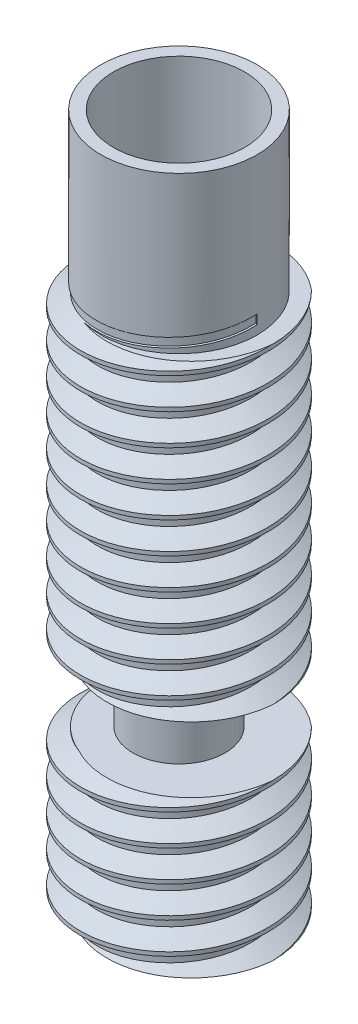
from build123d import *

# Parameters (mm, degrees)
ROSCA1_PITCH = 1
ROSCA2_PITCH = 1


with BuildPart() as part:
    # Croquis1 → Revolución1 (revolve)
    with BuildSketch(Plane.XY, mode=Mode.PRIVATE) as revoluci_n1_sk:
        Polygon((1, 0), (3, 0), (3, 5), (1.475, 5), (1.475, 7.1), (3, 7.1), (3, 17.1), (2.5, 17.1), (2.5, 22.1), (2.1, 22.1), (2.1, 17.1), (1, 16.9), align=None)
    revolve(revoluci_n1_sk.sketch.rotate(Axis((0, 0, 0), (0, 1, 0)), 90), axis=Axis((0, 0, 0), (0, 1, 0)))

    # Rosca1: the profile of Perfil de rosca1 profile screwed along a right-hand helix of 6 turns, 8 arcs to a turn; built about Z, then put on its axis
    rosca1_z = Axis((0, 0, 0), (0, 0, 1))
    rosca1_corners = [(3.0003, 0, -0.000173205), (3.0003, 0, 0.875173202), (2.458734125, 0, 0.562499999), (2.458734125, 0, 0.312499999)]
    with BuildLine(mode=Mode.PRIVATE) as rosca1_profile:
        Line(rosca1_corners[0], rosca1_corners[1])
        Line(rosca1_corners[1], rosca1_corners[2])
        Line(rosca1_corners[2], rosca1_corners[3])
        Line(rosca1_corners[3], rosca1_corners[0])
    rosca1_cap = Face(rosca1_profile.wire())
    rosca1_turn_angles = [0, 22.5, 45, 67.5, 90, 112.5, 135, 157.5, 180, 202.5, 225, 247.5, 270, 292.5, 315, 337.5, 360]
    rosca1_turn_weights = [1, 0.9238795325112867, 1, 0.9238795325112867, 1, 0.9238795325112867, 1, 0.9238795325112867, 1, 0.9238795325112867, 1, 0.9238795325112867, 1, 0.9238795325112867, 1, 0.9238795325112867, 1]
    rosca1_turn_rails = [Edge.make_bspline([Vector(p[0], p[1], 0).rotate(rosca1_z, rosca1_turn_angles[k]) / rosca1_turn_weights[k] + Vector(0, 0, p[2] + ROSCA1_PITCH * rosca1_turn_angles[k] / 360) for k in range(17)], [0, 0, 0, 1, 1, 2, 2, 3, 3, 4, 4, 5, 5, 6, 6, 7, 7, 8, 8, 8], 2, rosca1_turn_weights) for p in rosca1_corners]
    rosca1_turn_sides = [Face.make_surface_from_curves(rosca1_turn_rails[p[0]], rosca1_turn_rails[p[1]]) for p in [(0, 1), (1, 2), (2, 3), (3, 0)]]
    rosca1 = Plane(origin=(0, -1, 0), x_dir=(1, 0, 0), z_dir=(0, 1, 0)) * Solid(Shell([*[p.moved(Location((0, 0, ROSCA1_PITCH * i))) for i in range(6) for p in rosca1_turn_sides], rosca1_cap, rosca1_cap.rotate(rosca1_z, 2160).moved(Location((0, 0, ROSCA1_PITCH * 2160 / 360)))]))
    add(rosca1, mode=Mode.SUBTRACT)

    # Rosca2: the profile of Perfil de rosca2 profile screwed along a right-hand helix of 11 turns, 8 arcs to a turn; built about Z, then put on its axis
    rosca2_z = Axis((0, 0, 0), (0, 0, 1))
    rosca2_corners = [(3.0003, 0, -0.000173205), (3.0003, 0, 0.875173202), (2.458734125, 0, 0.562499999), (2.458734125, 0, 0.312499999)]
    with BuildLine(mode=Mode.PRIVATE) as rosca2_profile:
        Line(rosca2_corners[0], rosca2_corners[1])
        Line(rosca2_corners[1], rosca2_corners[2])
        Line(rosca2_corners[2], rosca2_corners[3])
        Line(rosca2_corners[3], rosca2_corners[0])
    rosca2_cap = Face(rosca2_profile.wire())
    rosca2_turn_angles = [0, 22.5, 45, 67.5, 90, 112.5, 135, 157.5, 180, 202.5, 225, 247.5, 270, 292.5, 315, 337.5, 360]
    rosca2_turn_weights = [1, 0.9238795325112867, 1, 0.9238795325112867, 1, 0.9238795325112867, 1, 0.9238795325112867, 1, 0.9238795325112867, 1, 0.9238795325112867, 1, 0.9238795325112867, 1, 0.9238795325112867, 1]
    rosca2_turn_rails = [Edge.make_bspline([Vector(p[0], p[1], 0).rotate(rosca2_z, rosca2_turn_angles[k]) / rosca2_turn_weights[k] + Vector(0, 0, p[2] + ROSCA2_PITCH * rosca2_turn_angles[k] / 360) for k in range(17)], [0, 0, 0, 1, 1, 2, 2, 3, 3, 4, 4, 5, 5, 6, 6, 7, 7, 8, 8, 8], 2, rosca2_turn_weights) for p in rosca2_corners]
    rosca2_turn_sides = [Face.make_surface_from_curves(rosca2_turn_rails[p[0]], rosca2_turn_rails[p[1]]) for p in [(0, 1), (1, 2), (2, 3), (3, 0)]]
    rosca2 = Plane(origin=(0, 6.1, 0), x_dir=(1, 0, 0), z_dir=(0, 1, 0)) * Solid(Shell([*[p.moved(Location((0, 0, ROSCA2_PITCH * i))) for i in range(11) for p in rosca2_turn_sides], rosca2_cap, rosca2_cap.rotate(rosca2_z, 3960).moved(Location((0, 0, ROSCA2_PITCH * 3960 / 360)))]))
    add(rosca2, mode=Mode.SUBTRACT)


solid = part.part
